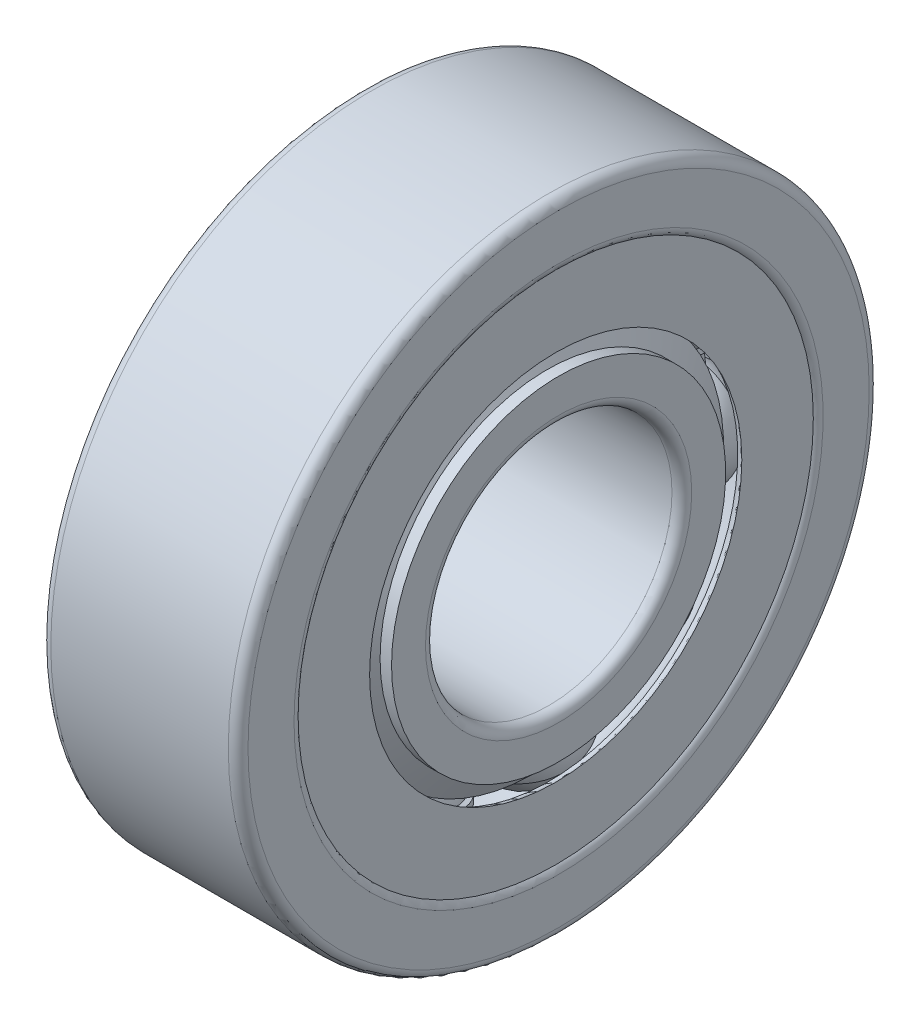
from build123d import *

# Parameters (mm, degrees)
SKETCH_5_W               = 0.5999999999999999
SKETCH_5_H               = 0.39999999999999947
PATTERN_CIRCULAR_5_COUNT = 11
PATTERN_CIRCULAR_2_COUNT = 11


with BuildPart() as part:
    # 草图2 → 旋转1 (revolve)
    with BuildSketch(Plane.XY):
        with BuildLine():
            Line((1.51111111111111, 3.8333333333333353), (1.7677112307509428, 3.388888888888891))
            Line((1.7677112307509428, 3.388888888888891), (1.9999999999999978, 3.388888888888891))
            Line((1.9999999999999978, 3.388888888888891), (1.9999999999999982, 2.7000000000000024))
            ThreePointArc((1.9999999999999982, 2.7000000000000024), (1.9414213562373082, 2.5585786437626927), (1.7999999999999985, 2.500000000000002))
            Line((1.7999999999999985, 2.500000000000002), (-1.8000000000000005, 2.5000000000000013))
            ThreePointArc((-1.8000000000000005, 2.5000000000000013), (-1.9414213562373104, 2.5585786437626923), (-2.000000000000001, 2.700000000000002))
            Line((-2.000000000000001, 2.700000000000002), (-1.9999999999999962, 3.388888888888891))
            Line((-1.9999999999999962, 3.388888888888891), (-1.7677112307509406, 3.388888888888891))
            Line((-1.7677112307509406, 3.388888888888891), (-1.5111111111111077, 3.8333333333333344))
            Line((-1.5111111111111077, 3.8333333333333344), (-0.7453559924999281, 3.8333333333333353))
            ThreePointArc((-0.7453559924999281, 3.8333333333333353), (1.72e-15, 3.5000000000000004), (0.7453559924999301, 3.8333333333333353))
            Line((0.7453559924999301, 3.8333333333333353), (1.51111111111111, 3.8333333333333353))
        make_face()
        with BuildLine():
            Line((-2.000000000000001, 6.3), (-2.000000000000001, 5.366666666666665))
            ThreePointArc((-2.000000000000001, 5.366666666666665), (-1.9414213562373104, 5.225245310429356), (-1.8000000000000012, 5.166666666666666))
            Line((-1.8000000000000012, 5.166666666666666), (-0.7453559924999256, 5.166666666666667))
            ThreePointArc((-0.7453559924999256, 5.166666666666667), (1.5e-15, 5.4999999999999964), (0.7453559924999272, 5.166666666666667))
            Line((0.7453559924999272, 5.166666666666667), (1.8000000000000047, 5.166666666666667))
            ThreePointArc((1.8000000000000047, 5.166666666666667), (1.9414213562373177, 5.225245310429359), (2.000000000000011, 5.366666666666671))
            Line((2.000000000000011, 5.366666666666671), (1.9999999999999973, 6.300000000000001))
            ThreePointArc((1.9999999999999973, 6.300000000000001), (1.941421356237307, 6.44142135623731), (1.7999999999999983, 6.500000000000001))
            Line((1.7999999999999983, 6.500000000000001), (-1.8000000000000016, 6.5))
            ThreePointArc((-1.8000000000000016, 6.5), (-1.9414213562373113, 6.441421356237309), (-2.000000000000001, 6.3))
        make_face()
    revolve(axis=Axis((-3.4999999999999996, 0, 0), (1, 0, 0)))


with BuildPart() as body_2:
    # 草图5 → 旋转3 (revolve)
    with BuildSketch(Plane.XY):
        with Locations((3.8e-15, 4.5)):
            Rectangle(SKETCH_5_W, SKETCH_5_H)
    revolve(axis=Axis((-19.927092192426834, 0, 0), (1, 0, 0)))



with BuildPart() as body_3:
    # 草图3 → 旋转2 (revolve)
    with BuildSketch(Plane.XY):
        with BuildLine():
            ThreePointArc((1.099999999999997, 4.5), (1.5e-16, 5.599999999999994), (-1.099999999999997, 4.5))
            Line((-1.0999999999999968, 4.5), (1.0999999999999968, 4.5))
        make_face()
    revolve(axis=Axis((-1.0999999999999968, 4.5, 0), (1, 0, 0)))


with BuildPart() as pattern_circular_5_1:
    # 阵列(圆周)5: pattern copy
    add(body_3.part.rotate(Axis((-3.8500000000000054, 0, 0), (1, 0, 0)), 1 * 360 / PATTERN_CIRCULAR_5_COUNT))


with BuildPart() as pattern_circular_5_2:
    # 阵列(圆周)5: pattern copy
    add(body_3.part.rotate(Axis((-3.8500000000000054, 0, 0), (1, 0, 0)), 2 * 360 / PATTERN_CIRCULAR_5_COUNT))


with BuildPart() as pattern_circular_5_3:
    # 阵列(圆周)5: pattern copy
    add(body_3.part.rotate(Axis((-3.8500000000000054, 0, 0), (1, 0, 0)), 3 * 360 / PATTERN_CIRCULAR_5_COUNT))


with BuildPart() as pattern_circular_5_4:
    # 阵列(圆周)5: pattern copy
    add(body_3.part.rotate(Axis((-3.8500000000000054, 0, 0), (1, 0, 0)), 4 * 360 / PATTERN_CIRCULAR_5_COUNT))


with BuildPart() as pattern_circular_5_5:
    # 阵列(圆周)5: pattern copy
    add(body_3.part.rotate(Axis((-3.8500000000000054, 0, 0), (1, 0, 0)), 5 * 360 / PATTERN_CIRCULAR_5_COUNT))


with BuildPart() as pattern_circular_5_6:
    # 阵列(圆周)5: pattern copy
    add(body_3.part.rotate(Axis((-3.8500000000000054, 0, 0), (1, 0, 0)), 6 * 360 / PATTERN_CIRCULAR_5_COUNT))


with BuildPart() as pattern_circular_5_7:
    # 阵列(圆周)5: pattern copy
    add(body_3.part.rotate(Axis((-3.8500000000000054, 0, 0), (1, 0, 0)), 7 * 360 / PATTERN_CIRCULAR_5_COUNT))


with BuildPart() as pattern_circular_5_8:
    # 阵列(圆周)5: pattern copy
    add(body_3.part.rotate(Axis((-3.8500000000000054, 0, 0), (1, 0, 0)), 8 * 360 / PATTERN_CIRCULAR_5_COUNT))


with BuildPart() as pattern_circular_5_9:
    # 阵列(圆周)5: pattern copy
    add(body_3.part.rotate(Axis((-3.8500000000000054, 0, 0), (1, 0, 0)), 9 * 360 / PATTERN_CIRCULAR_5_COUNT))


with BuildPart() as pattern_circular_5_10:
    # 阵列(圆周)5: pattern copy
    add(body_3.part.rotate(Axis((-3.8500000000000054, 0, 0), (1, 0, 0)), 10 * 360 / PATTERN_CIRCULAR_5_COUNT))


with BuildPart() as cut_revolve_1_tool:
    # 草图6 → 切除-旋转1 (revolve)
    with BuildSketch(Plane.XY):
        with BuildLine():
            Line((-1.0816653826391938, 4.699999999999999), (1.0816653826391938, 4.699999999999999))
            ThreePointArc((1.0816653826391938, 4.699999999999999), (2.1e-15, 5.599999999999994), (-1.0816653826391938, 4.699999999999999))
        make_face()
        with BuildLine():
            Line((-1.0816653826391938, 4.3), (1.0816653826391938, 4.3))
            ThreePointArc((1.0816653826391938, 4.3), (2.35e-15, 3.4000000000000004), (-1.0816653826391938, 4.3))
        make_face()
    revolve(axis=Axis((-19.927092192426834, 0, 0), (1, 0, 0)))


with BuildPart() as part_1:
    add(part.part)

    # 切除-旋转1: cut by cut_revolve_1_tool
    add(cut_revolve_1_tool.part, mode=Mode.SUBTRACT)

    # 草图9 → 旋转5 (revolve)
    with BuildSketch(Plane.XY):
        with BuildLine():
            Line((1.8000000000000047, 5.166666666666667), (1.8000000000000014, 3.8333333333333326))
            ThreePointArc((1.8000000000000014, 3.8333333333333326), (1.8765366864730204, 3.818109239835597), (1.9414213562373135, 3.7747546895706496))
            Line((1.9414213562373135, 3.7747546895706496), (1.9414213562373166, 5.225245310429358))
            ThreePointArc((1.9414213562373166, 5.225245310429358), (1.876536686473024, 5.18189076016441), (1.8000000000000047, 5.166666666666667))
        make_face()
        with BuildLine():
            Line((-1.9414213562373144, 5.225245310429357), (-1.941421356237311, 3.7747546895706487))
            ThreePointArc((-1.941421356237311, 3.7747546895706487), (-1.876536686473018, 3.818109239835596), (-1.799999999999999, 3.8333333333333326))
            Line((-1.799999999999999, 3.8333333333333326), (-1.8000000000000025, 5.166666666666666))
            ThreePointArc((-1.8000000000000025, 5.166666666666666), (-1.8765366864730217, 5.181890760164409), (-1.9414213562373144, 5.225245310429357))
        make_face()
    revolve(axis=Axis((-19.927092192426834, 0, 0), (1, 0, 0)))


with BuildPart() as body_3_1:
    add(body_3.part)

    # 切除-旋转1: cut by cut_revolve_1_tool
    add(cut_revolve_1_tool.part, mode=Mode.SUBTRACT)


with BuildPart() as pattern_circular_5_1_1:
    add(pattern_circular_5_1.part)

    # 切除-旋转1: cut by cut_revolve_1_tool
    add(cut_revolve_1_tool.part, mode=Mode.SUBTRACT)


with BuildPart() as pattern_circular_5_2_1:
    add(pattern_circular_5_2.part)

    # 切除-旋转1: cut by cut_revolve_1_tool
    add(cut_revolve_1_tool.part, mode=Mode.SUBTRACT)


with BuildPart() as pattern_circular_5_3_1:
    add(pattern_circular_5_3.part)

    # 切除-旋转1: cut by cut_revolve_1_tool
    add(cut_revolve_1_tool.part, mode=Mode.SUBTRACT)


with BuildPart() as pattern_circular_5_4_1:
    add(pattern_circular_5_4.part)

    # 切除-旋转1: cut by cut_revolve_1_tool
    add(cut_revolve_1_tool.part, mode=Mode.SUBTRACT)


with BuildPart() as pattern_circular_5_5_1:
    add(pattern_circular_5_5.part)

    # 切除-旋转1: cut by cut_revolve_1_tool
    add(cut_revolve_1_tool.part, mode=Mode.SUBTRACT)


with BuildPart() as pattern_circular_5_6_1:
    add(pattern_circular_5_6.part)

    # 切除-旋转1: cut by cut_revolve_1_tool
    add(cut_revolve_1_tool.part, mode=Mode.SUBTRACT)


with BuildPart() as pattern_circular_5_7_1:
    add(pattern_circular_5_7.part)

    # 切除-旋转1: cut by cut_revolve_1_tool
    add(cut_revolve_1_tool.part, mode=Mode.SUBTRACT)


with BuildPart() as pattern_circular_5_8_1:
    add(pattern_circular_5_8.part)

    # 切除-旋转1: cut by cut_revolve_1_tool
    add(cut_revolve_1_tool.part, mode=Mode.SUBTRACT)


with BuildPart() as pattern_circular_5_9_1:
    add(pattern_circular_5_9.part)

    # 切除-旋转1: cut by cut_revolve_1_tool
    add(cut_revolve_1_tool.part, mode=Mode.SUBTRACT)


with BuildPart() as pattern_circular_5_10_1:
    add(pattern_circular_5_10.part)

    # 切除-旋转1: cut by cut_revolve_1_tool
    add(cut_revolve_1_tool.part, mode=Mode.SUBTRACT)


with BuildPart() as body_2_1:
    add(body_2.part)

    add(body_3_1.part)  # 旋转4 merges body 3
    # 草图7 → 旋转4 (revolve)
    with BuildSketch(Plane.XY):
        with BuildLine():
            Line((-0.9999999999999961, 4.5), (0.9999999999999961, 4.5))
            ThreePointArc((0.9999999999999961, 4.5), (2.83e-15, 5.499999999999993), (-0.9999999999999961, 4.5))
        make_face()
    revolve_4 = revolve(axis=Axis((-0.9999999999999961, 4.5, 0), (1, 0, 0)))

    # 阵列(圆周)2: 旋转4 ×11 about axis
    pattern_circular_2_axis = Axis((-3.8500000000000054, 0, 0), (1, 0, 0))
    for i in range(1, PATTERN_CIRCULAR_2_COUNT):
        add(revolve_4.rotate(pattern_circular_2_axis, i * 360 / PATTERN_CIRCULAR_2_COUNT))


solid = Compound([part_1.part, pattern_circular_5_1_1.part, pattern_circular_5_2_1.part, pattern_circular_5_3_1.part, pattern_circular_5_4_1.part, pattern_circular_5_5_1.part, pattern_circular_5_6_1.part, pattern_circular_5_7_1.part, pattern_circular_5_8_1.part, pattern_circular_5_9_1.part, pattern_circular_5_10_1.part, body_2_1.part])
